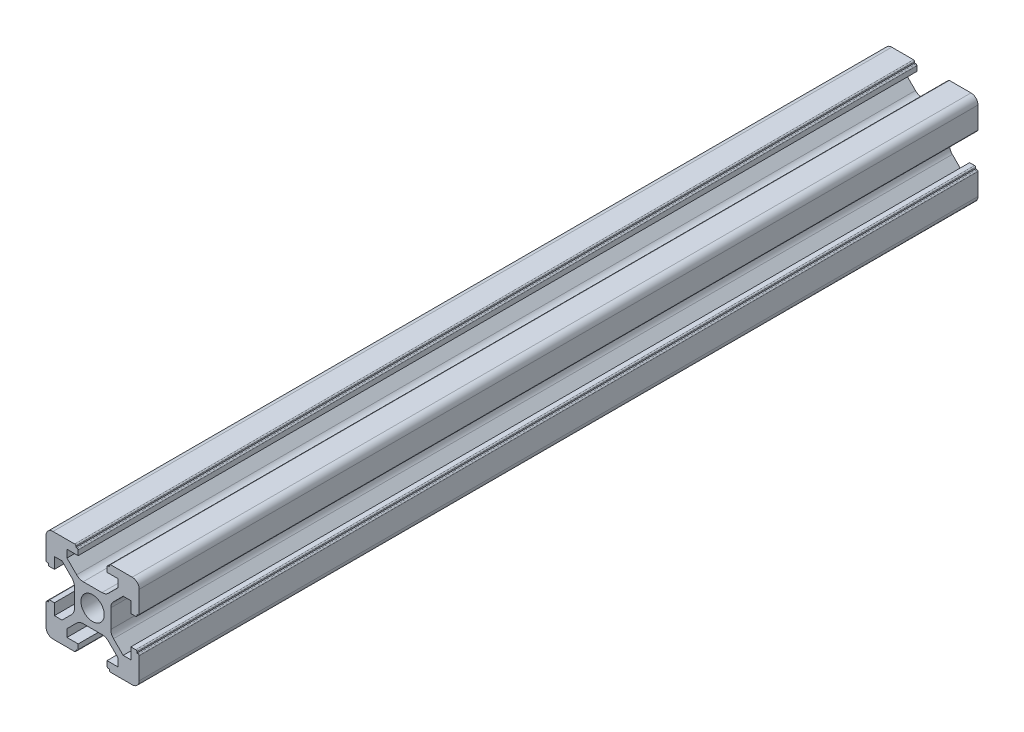
from build123d import *

# Parameters (mm, degrees)
SKETCH1_R           = 2.5
BOSS_EXTRUDE1_DEPTH = 180


with BuildPart() as part:
    # Sketch1 → Boss-Extrude1 (new body)
    with BuildSketch(Plane.XY):
        with BuildLine():
            Line((-8.5, 10), (-3.85, 10))
            ThreePointArc((-3.85, 10), (-3.673223305, 9.926776695), (-3.6, 9.75))
            Line((-3.6, 9.75), (-3.6, 9.5))
            Line((-3.6, 9.5), (-3.35, 9.5))
            ThreePointArc((-3.35, 9.5), (-3.173223305, 9.426776695), (-3.1, 9.25))
            Line((-3.1, 9.25), (-3.1, 8.2))
            Line((-3.1, 8.2), (-5.5, 8.2))
            Line((-5.5, 8.2), (-5.5, 6.560660172))
            Line((-5.5, 6.560660172), (-3.425126266, 4.485786438))
            ThreePointArc((-3.425126266, 4.485786438), (-2.776279568, 4.052240935), (-2.010912703, 3.9))
            Line((-2.010912703, 3.9), (2.010912703, 3.9))
            ThreePointArc((2.010912703, 3.9), (2.776279568, 4.052240935), (3.425126266, 4.485786438))
            Line((3.425126266, 4.485786438), (5.5, 6.560660172))
            Line((5.5, 6.560660172), (5.5, 8.2))
            Line((5.5, 8.2), (3.1, 8.2))
            Line((3.1, 8.2), (3.1, 9.25))
            ThreePointArc((3.1, 9.25), (3.173223305, 9.426776695), (3.35, 9.5))
            Line((3.35, 9.5), (3.6, 9.5))
            Line((3.6, 9.5), (3.6, 9.75))
            ThreePointArc((3.6, 9.75), (3.673223305, 9.926776695), (3.85, 10))
            Line((3.85, 10), (8.5, 10))
            ThreePointArc((8.5, 10), (9.560660172, 9.560660172), (10, 8.5))
            Line((10, 8.5), (10, 3.85))
            ThreePointArc((10, 3.85), (9.926776695, 3.673223305), (9.75, 3.6))
            Line((9.75, 3.6), (9.5, 3.6))
            Line((9.5, 3.6), (9.5, 3.35))
            ThreePointArc((9.5, 3.35), (9.426776695, 3.173223305), (9.25, 3.1))
            Line((9.25, 3.1), (8.2, 3.1))
            Line((8.2, 3.1), (8.2, 5.5))
            Line((8.2, 5.5), (6.560660172, 5.5))
            Line((6.560660172, 5.5), (4.485786438, 3.425126266))
            ThreePointArc((4.485786438, 3.425126266), (4.052240935, 2.776279568), (3.9, 2.010912703))
            Line((3.9, 2.010912703), (3.9, -2.010912703))
            ThreePointArc((3.9, -2.010912703), (4.052240935, -2.776279568), (4.485786438, -3.425126266))
            Line((4.485786438, -3.425126266), (6.560660172, -5.5))
            Line((6.560660172, -5.5), (8.2, -5.5))
            Line((8.2, -5.5), (8.2, -3.1))
            Line((8.2, -3.1), (9.25, -3.1))
            ThreePointArc((9.25, -3.1), (9.426776695, -3.173223305), (9.5, -3.35))
            Line((9.5, -3.35), (9.5, -3.6))
            Line((9.5, -3.6), (9.75, -3.6))
            ThreePointArc((9.75, -3.6), (9.926776695, -3.673223305), (10, -3.85))
            Line((10, -3.85), (10, -8.5))
            ThreePointArc((10, -8.5), (9.560660172, -9.560660172), (8.5, -10))
            Line((8.5, -10), (3.85, -10))
            ThreePointArc((3.85, -10), (3.673223305, -9.926776695), (3.6, -9.75))
            Line((3.6, -9.75), (3.6, -9.5))
            Line((3.6, -9.5), (3.35, -9.5))
            ThreePointArc((3.35, -9.5), (3.173223305, -9.426776695), (3.1, -9.25))
            Line((3.1, -9.25), (3.1, -8.2))
            Line((3.1, -8.2), (5.5, -8.2))
            Line((5.5, -8.2), (5.5, -6.560660172))
            Line((5.5, -6.560660172), (3.425126266, -4.485786438))
            ThreePointArc((3.425126266, -4.485786438), (2.776279568, -4.052240935), (2.010912703, -3.9))
            Line((2.010912703, -3.9), (-2.010912703, -3.9))
            ThreePointArc((-2.010912703, -3.9), (-2.776279568, -4.052240935), (-3.425126266, -4.485786438))
            Line((-3.425126266, -4.485786438), (-5.5, -6.560660172))
            Line((-5.5, -6.560660172), (-5.5, -8.2))
            Line((-5.5, -8.2), (-3.1, -8.2))
            Line((-3.1, -8.2), (-3.1, -9.25))
            ThreePointArc((-3.1, -9.25), (-3.173223305, -9.426776695), (-3.35, -9.5))
            Line((-3.35, -9.5), (-3.6, -9.5))
            Line((-3.6, -9.5), (-3.6, -9.75))
            ThreePointArc((-3.6, -9.75), (-3.673223305, -9.926776695), (-3.85, -10))
            Line((-3.85, -10), (-8.5, -10))
            ThreePointArc((-8.5, -10), (-9.560660172, -9.560660172), (-10, -8.5))
            Line((-10, -8.5), (-10, -3.85))
            ThreePointArc((-10, -3.85), (-9.926776695, -3.673223305), (-9.75, -3.6))
            Line((-9.75, -3.6), (-9.5, -3.6))
            Line((-9.5, -3.6), (-9.5, -3.35))
            ThreePointArc((-9.5, -3.35), (-9.426776695, -3.173223305), (-9.25, -3.1))
            Line((-9.25, -3.1), (-8.2, -3.1))
            Line((-8.2, -3.1), (-8.2, -5.5))
            Line((-8.2, -5.5), (-6.560660172, -5.5))
            Line((-6.560660172, -5.5), (-4.485786438, -3.425126266))
            ThreePointArc((-4.485786438, -3.425126266), (-4.052240935, -2.776279568), (-3.9, -2.010912703))
            Line((-3.9, -2.010912703), (-3.9, 2.010912703))
            ThreePointArc((-3.9, 2.010912703), (-4.052240935, 2.776279568), (-4.485786438, 3.425126266))
            Line((-4.485786438, 3.425126266), (-6.560660172, 5.5))
            Line((-6.560660172, 5.5), (-8.2, 5.5))
            Line((-8.2, 5.5), (-8.2, 3.1))
            Line((-8.2, 3.1), (-9.25, 3.1))
            ThreePointArc((-9.25, 3.1), (-9.426776695, 3.173223305), (-9.5, 3.35))
            Line((-9.5, 3.35), (-9.5, 3.6))
            Line((-9.5, 3.6), (-9.75, 3.6))
            ThreePointArc((-9.75, 3.6), (-9.926776695, 3.673223305), (-10, 3.85))
            Line((-10, 3.85), (-10, 8.5))
            ThreePointArc((-10, 8.5), (-9.560660172, 9.560660172), (-8.5, 10))
        make_face()
        Circle(SKETCH1_R, mode=Mode.SUBTRACT)
    extrude(amount=BOSS_EXTRUDE1_DEPTH)


solid = part.part
